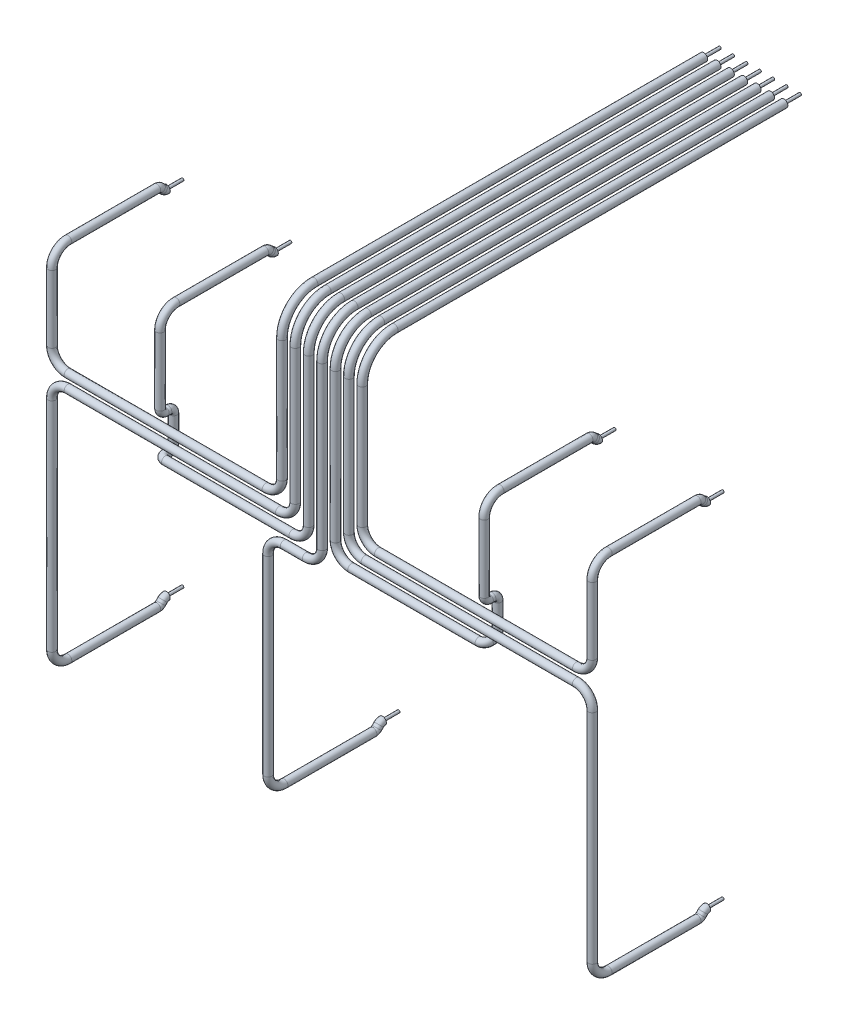
from build123d import *

# Parameters (mm, degrees)
NEGATIVE_R          = 0.25
SKETCH8_R           = 0.71
SKETCH8_R_2         = 0.25
CUT_EXTRUDE1_START  = -3
SKETCH9_R           = 0.71
SKETCH9_R_2         = 0.25
CUT_EXTRUDE1_DEPTH  = 3
SKETCH10_R          = 0.71
SKETCH10_R_2        = 0.25
CUT_EXTRUDE3_DEPTH  = 3
SKETCH2_R           = 0.25
SKETCH11_R          = 0.71
SKETCH11_R_2        = 0.25
SKETCH12_R          = 0.71
SKETCH12_R_2        = 0.25
CUT_EXTRUDE4_DEPTH  = 3
SKETCH13_R          = 0.71
SKETCH13_R_2        = 0.25
CUT_EXTRUDE7_DEPTH  = 3
SKETCH3_R           = 0.25
SKETCH14_R          = 0.71
SKETCH14_R_2        = 0.25
SKETCH15_R          = 0.71
SKETCH15_R_2        = 0.25
CUT_EXTRUDE8_DEPTH  = 3
SKETCH16_R          = 0.71
SKETCH16_R_2        = 0.25
CUT_EXTRUDE9_DEPTH  = 3
MIDDLE_R            = 0.25
SKETCH17_R          = 0.71
SKETCH17_R_2        = 0.25
SKETCH18_R          = 0.71
SKETCH18_R_2        = 0.25
CUT_EXTRUDE10_DEPTH = 3
SKETCH19_R          = 0.71
SKETCH19_R_2        = 0.25
CUT_EXTRUDE11_DEPTH = 3


with BuildPart() as part:
    # Sweep1: sweep along a curve in space
    with BuildLine() as sweep1_path:
        Line((-7.5, 0, 0), (-7.5, 0, 75.85))
        ThreePointArc((-7.5, 0, 75.85), (-7.5, -1.757359313, 80.092640687), (-7.5, -6, 81.85))
        Line((-7.5, -6, 81.85), (-7.5, -28.75, 81.85))
        ThreePointArc((-7.5, -28.75, 81.85), (-8.378679656, -30.871320344, 81.85), (-10.5, -31.75, 81.85))
        Line((-10.5, -31.75, 81.85), (-47.504644529, -31.75, 81.85))
        ThreePointArc((-47.504644529, -31.75, 81.85), (-49.625964873, -30.871320344, 81.85), (-50.504644529, -28.75, 81.85))
        Line((-50.504644529, -28.75, 81.85), (-50.504644529, -16.15, 81.85))
        ThreePointArc((-50.504644529, -16.15, 81.85), (-50.504644529, -14.028679656, 80.971320344), (-50.504644529, -13.15, 78.85))
        Line((-50.504644529, -13.15, 78.85), (-50.504644529, -13.15, 62.229159793))
        ThreePointArc((-50.504644529, -13.15, 62.229159793), (-50.503565756, -13.226112823, 61.846476361), (-50.500493671, -13.442863805, 61.522053012))
        Line((-50.500493671, -13.442863805, 61.522053012), (-50.495330714, -13.807136196, 61.157744035))
        ThreePointArc((-50.495330714, -13.807136196, 61.157744035), (-50.492258629, -14.023887177, 60.833320686), (-50.491179856, -14.1, 60.450637254))
        Line((-50.491179856, -14.1, 60.450637254), (-50.491179856, -14.1, 57.450637254))
    # negative → Sweep1 (sweep)
    with BuildSketch(Plane.XY):
        with Locations((-7.5, 0)):
            Circle(NEGATIVE_R)
    sweep(path=sweep1_path.line)


with BuildPart() as body_2:
    # Sweep7: sweep along a curve in space
    with BuildLine() as sweep7_path:
        Line((-7.5, 0, 0), (-7.5, 0, 75.85))
        ThreePointArc((-7.5, 0, 75.85), (-7.5, -1.757359313, 80.092640687), (-7.5, -6, 81.85))
        Line((-7.5, -6, 81.85), (-7.5, -28.75, 81.85))
        ThreePointArc((-7.5, -28.75, 81.85), (-8.378679656, -30.871320344, 81.85), (-10.5, -31.75, 81.85))
        Line((-10.5, -31.75, 81.85), (-47.504644529, -31.75, 81.85))
        ThreePointArc((-47.504644529, -31.75, 81.85), (-49.625964873, -30.871320344, 81.85), (-50.504644529, -28.75, 81.85))
        Line((-50.504644529, -28.75, 81.85), (-50.504644529, -16.15, 81.85))
        ThreePointArc((-50.504644529, -16.15, 81.85), (-50.504644529, -14.028679656, 80.971320344), (-50.504644529, -13.15, 78.85))
        Line((-50.504644529, -13.15, 78.85), (-50.504644529, -13.15, 62.229159793))
        ThreePointArc((-50.504644529, -13.15, 62.229159793), (-50.503565756, -13.226112823, 61.846476361), (-50.500493671, -13.442863805, 61.522053012))
        Line((-50.500493671, -13.442863805, 61.522053012), (-50.495330714, -13.807136196, 61.157744035))
        ThreePointArc((-50.495330714, -13.807136196, 61.157744035), (-50.492258629, -14.023887177, 60.833320686), (-50.491179856, -14.1, 60.450637254))
        Line((-50.491179856, -14.1, 60.450637254), (-50.491179856, -14.1, 57.450637254))
    # Sketch8 → Sweep7 (sweep)
    with BuildSketch(Plane(origin=(0, 0, 0), x_dir=(-1, 0, 0), z_dir=(0, 0, -1))):
        with Locations((7.5, 0)):
            Circle(SKETCH8_R)
        with Locations((7.5, 0)):
            Circle(SKETCH8_R_2, mode=Mode.SUBTRACT)
    sweep(path=sweep7_path.line)

    # Sketch9 → Cut-Extrude1 (cut)
    with BuildSketch(Plane(origin=(0, 0, 0), x_dir=(-1, 0, 0), z_dir=(0, 0, -1)).offset(CUT_EXTRUDE1_START)):
        with Locations((7.5, 0)):
            Circle(SKETCH9_R)
        with Locations((7.5, 0)):
            Circle(SKETCH9_R_2, mode=Mode.SUBTRACT)
    extrude(amount=CUT_EXTRUDE1_DEPTH, mode=Mode.SUBTRACT)

    # Sketch10 → Cut-Extrude3 (cut)
    with BuildSketch(Plane(origin=(0, 0, 57.450637254), x_dir=(-1, 0, 0), z_dir=(0, 0, -1))):
        with Locations((50.491179856, -14.1)):
            Circle(SKETCH10_R)
        with Locations((50.491179856, -14.1)):
            Circle(SKETCH10_R_2, mode=Mode.SUBTRACT)
    extrude(amount=-CUT_EXTRUDE3_DEPTH, mode=Mode.SUBTRACT)


with BuildPart() as body_3:
    # Sweep8: sweep along a curve in space
    with BuildLine() as sweep8_path:
        Line((-5, 0, 0), (-5, 0, 75.85))
        ThreePointArc((-5, 0, 75.85), (-5, -1.757359313, 80.092640687), (-5, -6, 81.85))
        Line((-5, -6, 81.85), (-5, -31.25, 81.85))
        ThreePointArc((-5, -31.25, 81.85), (-5.878679656, -33.371320344, 81.85), (-8, -34.25, 81.85))
        Line((-8, -34.25, 81.85), (-47.499, -34.25, 81.85))
        ThreePointArc((-47.499, -34.25, 81.85), (-49.620320344, -35.128679656, 81.85), (-50.499, -37.25, 81.85))
        Line((-50.499, -37.25, 81.85), (-50.499, -77.95, 81.85))
        ThreePointArc((-50.499, -77.95, 81.85), (-50.499, -80.071320344, 80.971320344), (-50.499, -80.95, 78.85))
        Line((-50.499, -80.95, 78.85), (-50.499, -80.95, 62.228427125))
        ThreePointArc((-50.499, -80.95, 62.228427125), (-50.499, -80.873879533, 61.845743692), (-50.499, -80.657106781, 61.521320344))
        Line((-50.499, -80.657106781, 61.521320344), (-50.499, -80.292893219, 61.157106781))
        ThreePointArc((-50.499, -80.292893219, 61.157106781), (-50.499, -80.076120468, 60.832683432), (-50.499, -80, 60.45))
        Line((-50.499, -80, 60.45), (-50.499, -80, 57.45))
    # Sketch2 → Sweep8 (sweep)
    with BuildSketch(Plane.XY):
        with Locations((-5, 0)):
            Circle(SKETCH2_R)
    sweep(path=sweep8_path.line)


with BuildPart() as body_4:
    # Sweep9: sweep along a curve in space
    with BuildLine() as sweep9_path:
        Line((-5, 0, 0), (-5, 0, 75.85))
        ThreePointArc((-5, 0, 75.85), (-5, -1.757359313, 80.092640687), (-5, -6, 81.85))
        Line((-5, -6, 81.85), (-5, -31.25, 81.85))
        ThreePointArc((-5, -31.25, 81.85), (-5.878679656, -33.371320344, 81.85), (-8, -34.25, 81.85))
        Line((-8, -34.25, 81.85), (-47.499, -34.25, 81.85))
        ThreePointArc((-47.499, -34.25, 81.85), (-49.620320344, -35.128679656, 81.85), (-50.499, -37.25, 81.85))
        Line((-50.499, -37.25, 81.85), (-50.499, -77.95, 81.85))
        ThreePointArc((-50.499, -77.95, 81.85), (-50.499, -80.071320344, 80.971320344), (-50.499, -80.95, 78.85))
        Line((-50.499, -80.95, 78.85), (-50.499, -80.95, 62.228427125))
        ThreePointArc((-50.499, -80.95, 62.228427125), (-50.499, -80.873879533, 61.845743692), (-50.499, -80.657106781, 61.521320344))
        Line((-50.499, -80.657106781, 61.521320344), (-50.499, -80.292893219, 61.157106781))
        ThreePointArc((-50.499, -80.292893219, 61.157106781), (-50.499, -80.076120468, 60.832683432), (-50.499, -80, 60.45))
        Line((-50.499, -80, 60.45), (-50.499, -80, 57.45))
    # Sketch11 → Sweep9 (sweep)
    with BuildSketch(Plane(origin=(0, 0, 0), x_dir=(-1, 0, 0), z_dir=(0, 0, -1))):
        with Locations((5, 0)):
            Circle(SKETCH11_R)
        with Locations((5, 0)):
            Circle(SKETCH11_R_2, mode=Mode.SUBTRACT)
    sweep(path=sweep9_path.line)

    # Sketch12 → Cut-Extrude4 (cut)
    with BuildSketch(Plane(origin=(0, 0, 0), x_dir=(-1, 0, 0), z_dir=(0, 0, -1))):
        with Locations((5, 0)):
            Circle(SKETCH12_R)
        with Locations((5, 0)):
            Circle(SKETCH12_R_2, mode=Mode.SUBTRACT)
    extrude(amount=-CUT_EXTRUDE4_DEPTH, mode=Mode.SUBTRACT)

    # Sketch13 → Cut-Extrude7 (cut)
    with BuildSketch(Plane(origin=(0, 0, 57.45), x_dir=(-1, 0, 0), z_dir=(0, 0, -1))):
        with Locations((50.499, -80)):
            Circle(SKETCH13_R)
        with Locations((50.499, -80)):
            Circle(SKETCH13_R_2, mode=Mode.SUBTRACT)
    extrude(amount=-CUT_EXTRUDE7_DEPTH, mode=Mode.SUBTRACT)


with BuildPart() as body_5:
    # Sweep10: sweep along a curve in space
    with BuildLine() as sweep10_path:
        Line((-2.5, 0, 0), (-2.5, 0, 75.85))
        ThreePointArc((-2.5, 0, 75.85), (-2.5, -1.757359313, 80.092640687), (-2.5, -6, 81.85))
        Line((-2.5, -6, 81.85), (-2.5, -33.75, 81.85))
        ThreePointArc((-2.5, -33.75, 81.85), (-3.378679656, -35.871320344, 81.85), (-5.5, -36.75, 81.85))
        Line((-5.5, -36.75, 81.85), (-29.299, -36.75, 81.85))
        ThreePointArc((-29.299, -36.75, 81.85), (-30.006106781, -36.75, 81.557106781), (-30.299, -36.75, 80.85))
        Line((-30.299, -36.75, 80.85), (-30.299, -36.75, 80.35))
        ThreePointArc((-30.299, -36.75, 80.35), (-30.299, -36.457106781, 79.642893219), (-30.299, -35.75, 79.35))
        Line((-30.299, -35.75, 79.35), (-30.299, -30.82179677, 79.35))
        ThreePointArc((-30.299, -30.82179677, 79.35), (-30.299, -30.114689989, 79.642893219), (-30.299, -29.82179677, 80.35))
        Line((-30.299, -29.82179677, 80.35), (-30.299, -29.82179677, 80.85))
        ThreePointArc((-30.299, -29.82179677, 80.85), (-30.299, -29.528903551, 81.557106781), (-30.299, -28.82179677, 81.85))
        Line((-30.299, -28.82179677, 81.85), (-30.299, -16.15, 81.85))
        ThreePointArc((-30.299, -16.15, 81.85), (-30.299, -14.028679656, 80.971320344), (-30.299, -13.15, 78.85))
        Line((-30.299, -13.15, 78.85), (-30.299, -13.15, 62.228427125))
        ThreePointArc((-30.299, -13.15, 62.228427125), (-30.299, -13.226120468, 61.845743692), (-30.299, -13.442893219, 61.521320344))
        Line((-30.299, -13.442893219, 61.521320344), (-30.299, -13.807106781, 61.157106781))
        ThreePointArc((-30.299, -13.807106781, 61.157106781), (-30.299, -14.023879533, 60.832683432), (-30.299, -14.1, 60.45))
        Line((-30.299, -14.1, 60.45), (-30.299, -14.1, 57.45))
    # Sketch3 → Sweep10 (sweep)
    with BuildSketch(Plane.XY):
        with Locations((-2.5, 0)):
            Circle(SKETCH3_R)
    sweep(path=sweep10_path.line)


with BuildPart() as body_6:
    # Sweep11: sweep along a curve in space
    with BuildLine() as sweep11_path:
        Line((-2.5, 0, 0), (-2.5, 0, 75.85))
        ThreePointArc((-2.5, 0, 75.85), (-2.5, -1.757359313, 80.092640687), (-2.5, -6, 81.85))
        Line((-2.5, -6, 81.85), (-2.5, -33.75, 81.85))
        ThreePointArc((-2.5, -33.75, 81.85), (-3.378679656, -35.871320344, 81.85), (-5.5, -36.75, 81.85))
        Line((-5.5, -36.75, 81.85), (-29.299, -36.75, 81.85))
        ThreePointArc((-29.299, -36.75, 81.85), (-30.006106781, -36.75, 81.557106781), (-30.299, -36.75, 80.85))
        Line((-30.299, -36.75, 80.85), (-30.299, -36.75, 80.35))
        ThreePointArc((-30.299, -36.75, 80.35), (-30.299, -36.457106781, 79.642893219), (-30.299, -35.75, 79.35))
        Line((-30.299, -35.75, 79.35), (-30.299, -30.82179677, 79.35))
        ThreePointArc((-30.299, -30.82179677, 79.35), (-30.299, -30.114689989, 79.642893219), (-30.299, -29.82179677, 80.35))
        Line((-30.299, -29.82179677, 80.35), (-30.299, -29.82179677, 80.85))
        ThreePointArc((-30.299, -29.82179677, 80.85), (-30.299, -29.528903551, 81.557106781), (-30.299, -28.82179677, 81.85))
        Line((-30.299, -28.82179677, 81.85), (-30.299, -16.15, 81.85))
        ThreePointArc((-30.299, -16.15, 81.85), (-30.299, -14.028679656, 80.971320344), (-30.299, -13.15, 78.85))
        Line((-30.299, -13.15, 78.85), (-30.299, -13.15, 62.228427125))
        ThreePointArc((-30.299, -13.15, 62.228427125), (-30.299, -13.226120468, 61.845743692), (-30.299, -13.442893219, 61.521320344))
        Line((-30.299, -13.442893219, 61.521320344), (-30.299, -13.807106781, 61.157106781))
        ThreePointArc((-30.299, -13.807106781, 61.157106781), (-30.299, -14.023879533, 60.832683432), (-30.299, -14.1, 60.45))
        Line((-30.299, -14.1, 60.45), (-30.299, -14.1, 57.45))
    # Sketch14 → Sweep11 (sweep)
    with BuildSketch(Plane(origin=(0, 0, 0), x_dir=(-1, 0, 0), z_dir=(0, 0, -1))):
        with Locations((2.5, 0)):
            Circle(SKETCH14_R)
        with Locations((2.5, 0)):
            Circle(SKETCH14_R_2, mode=Mode.SUBTRACT)
    sweep(path=sweep11_path.line)

    # Sketch15 → Cut-Extrude8 (cut)
    with BuildSketch(Plane(origin=(0, 0, 57.45), x_dir=(-1, 0, 0), z_dir=(0, 0, -1))):
        with Locations((30.299, -14.1)):
            Circle(SKETCH15_R)
        with Locations((30.299, -14.1)):
            Circle(SKETCH15_R_2, mode=Mode.SUBTRACT)
    extrude(amount=-CUT_EXTRUDE8_DEPTH, mode=Mode.SUBTRACT)

    # Sketch16 → Cut-Extrude9 (cut)
    with BuildSketch(Plane(origin=(0, 0, 0), x_dir=(-1, 0, 0), z_dir=(0, 0, -1))):
        with Locations((2.5, 0)):
            Circle(SKETCH16_R)
        with Locations((2.5, 0)):
            Circle(SKETCH16_R_2, mode=Mode.SUBTRACT)
    extrude(amount=-CUT_EXTRUDE9_DEPTH, mode=Mode.SUBTRACT)


with BuildPart() as body_7:
    # Sweep12: sweep along a curve in space
    with BuildLine() as sweep12_path:
        Line((0, 0, 0), (0, 0, 75.85))
        ThreePointArc((0, 0, 75.85), (0, -1.757359313, 80.092640687), (0, -6, 81.85))
        Line((0, -6, 81.85), (0, -36.25, 81.85))
        ThreePointArc((0, -36.25, 81.85), (-0.878679656, -38.371320344, 81.85), (-3, -39.25, 81.85))
        Line((-3, -39.25, 81.85), (-7.099, -39.25, 81.85))
        ThreePointArc((-7.099, -39.25, 81.85), (-9.220320344, -40.128679656, 81.85), (-10.099, -42.25, 81.85))
        Line((-10.099, -42.25, 81.85), (-10.099, -77.95, 81.85))
        ThreePointArc((-10.099, -77.95, 81.85), (-10.099, -80.071320344, 80.971320344), (-10.099, -80.95, 78.85))
        Line((-10.099, -80.95, 78.85), (-10.099, -80.95, 62.228427125))
        ThreePointArc((-10.099, -80.95, 62.228427125), (-10.099, -80.873879533, 61.845743692), (-10.099, -80.657106781, 61.521320344))
        Line((-10.099, -80.657106781, 61.521320344), (-10.099, -80.292893219, 61.157106781))
        ThreePointArc((-10.099, -80.292893219, 61.157106781), (-10.099, -80.076120468, 60.832683432), (-10.099, -80, 60.45))
        Line((-10.099, -80, 60.45), (-10.099, -80, 57.45))
    # middle → Sweep12 (sweep)
    with BuildSketch(Plane.XY):
        Circle(MIDDLE_R)
    sweep(path=sweep12_path.line)


with BuildPart() as body_8:
    # Sweep13: sweep along a curve in space
    with BuildLine() as sweep13_path:
        Line((0, 0, 0), (0, 0, 75.85))
        ThreePointArc((0, 0, 75.85), (0, -1.757359313, 80.092640687), (0, -6, 81.85))
        Line((0, -6, 81.85), (0, -36.25, 81.85))
        ThreePointArc((0, -36.25, 81.85), (-0.878679656, -38.371320344, 81.85), (-3, -39.25, 81.85))
        Line((-3, -39.25, 81.85), (-7.099, -39.25, 81.85))
        ThreePointArc((-7.099, -39.25, 81.85), (-9.220320344, -40.128679656, 81.85), (-10.099, -42.25, 81.85))
        Line((-10.099, -42.25, 81.85), (-10.099, -77.95, 81.85))
        ThreePointArc((-10.099, -77.95, 81.85), (-10.099, -80.071320344, 80.971320344), (-10.099, -80.95, 78.85))
        Line((-10.099, -80.95, 78.85), (-10.099, -80.95, 62.228427125))
        ThreePointArc((-10.099, -80.95, 62.228427125), (-10.099, -80.873879533, 61.845743692), (-10.099, -80.657106781, 61.521320344))
        Line((-10.099, -80.657106781, 61.521320344), (-10.099, -80.292893219, 61.157106781))
        ThreePointArc((-10.099, -80.292893219, 61.157106781), (-10.099, -80.076120468, 60.832683432), (-10.099, -80, 60.45))
        Line((-10.099, -80, 60.45), (-10.099, -80, 57.45))
    # Sketch17 → Sweep13 (sweep)
    with BuildSketch(Plane(origin=(0, 0, 0), x_dir=(-1, 0, 0), z_dir=(0, 0, -1))):
        Circle(SKETCH17_R)
        Circle(SKETCH17_R_2, mode=Mode.SUBTRACT)
    sweep(path=sweep13_path.line)

    # Sketch18 → Cut-Extrude10 (cut)
    with BuildSketch(Plane(origin=(0, 0, 0), x_dir=(-1, 0, 0), z_dir=(0, 0, -1))):
        Circle(SKETCH18_R)
        Circle(SKETCH18_R_2, mode=Mode.SUBTRACT)
    extrude(amount=-CUT_EXTRUDE10_DEPTH, mode=Mode.SUBTRACT)

    # Sketch19 → Cut-Extrude11 (cut)
    with BuildSketch(Plane(origin=(0, 0, 57.45), x_dir=(-1, 0, 0), z_dir=(0, 0, -1))):
        with Locations((10.099, -80)):
            Circle(SKETCH19_R)
        with Locations((10.099, -80)):
            Circle(SKETCH19_R_2, mode=Mode.SUBTRACT)
    extrude(amount=-CUT_EXTRUDE11_DEPTH, mode=Mode.SUBTRACT)


with BuildPart() as body_9:
    # Mirror2: mirrored copy
    add(body_5.part.mirror(Plane(origin=(0, 0, 0), x_dir=(0, 0, 1), z_dir=(1, 0, 0))))


with BuildPart() as body_10:
    # Mirror2 2: mirrored copy
    add(body_6.part.mirror(Plane(origin=(0, 0, 0), x_dir=(0, 0, 1), z_dir=(1, 0, 0))))


with BuildPart() as body_11:
    # Mirror2 3: mirrored copy
    add(body_3.part.mirror(Plane(origin=(0, 0, 0), x_dir=(0, 0, 1), z_dir=(1, 0, 0))))


with BuildPart() as body_12:
    # Mirror2 4: mirrored copy
    add(body_4.part.mirror(Plane(origin=(0, 0, 0), x_dir=(0, 0, 1), z_dir=(1, 0, 0))))


with BuildPart() as body_13:
    # Mirror2 5: mirrored copy
    add(body_2.part.mirror(Plane(origin=(0, 0, 0), x_dir=(0, 0, 1), z_dir=(1, 0, 0))))


with BuildPart() as body_14:
    # Mirror2 6: mirrored copy
    add(part.part.mirror(Plane(origin=(0, 0, 0), x_dir=(0, 0, 1), z_dir=(1, 0, 0))))


solid = Compound([part.part, body_2.part, body_3.part, body_4.part, body_5.part, body_6.part, body_7.part, body_8.part, body_9.part, body_10.part, body_11.part, body_12.part, body_13.part, body_14.part])
